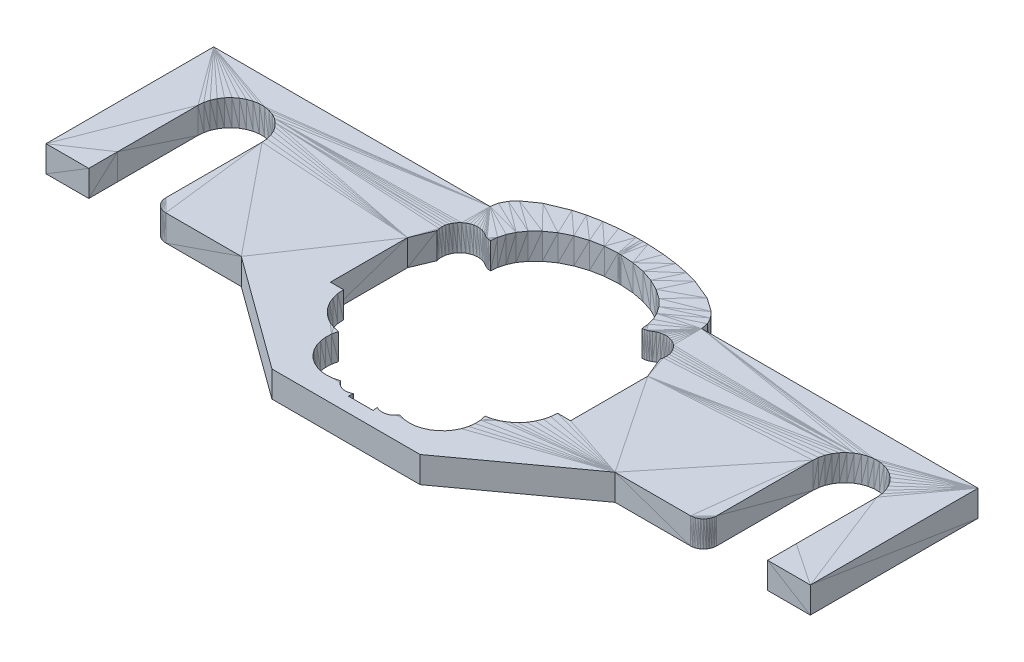
from build123d import *

# Parameters (mm, degrees)
MIRROR1_DEPTH       = 1.000000047
SKETCH2_W           = 5.756036673
SKETCH2_H           = 6.757314353
CUT_EXTRUDE1_DEPTH  = 10
SKETCH3_W           = 5.669474602
SKETCH3_H           = 1.123636748
BOSS_EXTRUDE1_DEPTH = 1
BOSS_EXTRUDE2_DEPTH = 1
CUT_EXTRUDE2_DEPTH  = 1


with BuildPart() as part:
    # Mirror1: read off the stored shape, not the designer's step
    # Mirror1 outline → Mirror1 (new body)
    with BuildSketch(Plane(origin=(0, 0, 0), x_dir=(1, 0, 0), z_dir=(0, 1, 0))):
        Polygon((1.400031033, -57.536032051), (0.860378146, -57.467374951), (0.228151679, -57.430211455), (0.047571957, -57.427730411), (0, -57.429641485), (-0.047571957, -57.427730411), (-0.228151679, -57.430211455), (-0.860378146, -57.467374951), (-1.400031033, -57.536032051), (-1.914553461, -57.637315243), (-2.355947858, -57.757604867), (-3.141701221, -58.081086725), (-3.6707744, -58.451257646), (-3.868654137, -58.67639184), (-3.999829292, -58.925494552), (-4.047423135, -59.198364615), (-14.628447592, -59.198364615), (-14.628447592, -65.615788102), (-12.991353869, -65.615788102), (-12.991353869, -64.515918493), (-12.991957366, -61.430227011), (-12.975260615, -61.228711158), (-12.925617397, -61.032690108), (-12.844391167, -60.847509652), (-12.733794749, -60.678228736), (-12.596838176, -60.529459268), (-12.437269092, -60.405258089), (-12.259431183, -60.30901894), (-12.06818223, -60.243360698), (-11.868730187, -60.210078955), (-11.66652143, -60.210078955), (-11.467069387, -60.243360698), (-11.275820434, -60.30901894), (-11.097982526, -60.405258089), (-10.938405991, -60.529459268), (-10.801456869, -60.678228736), (-10.69086045, -60.847509652), (-10.609634221, -61.032690108), (-10.559991002, -61.228711158), (-10.543294251, -61.430227011), (-10.543294251, -65.115787089), (-10.537140071, -65.194003284), (-10.518819094, -65.270297229), (-10.488800704, -65.342783928), (-10.447799228, -65.409682691), (-10.396845639, -65.46933949), (-10.33718884, -65.520294011), (-10.270290077, -65.561294556), (-10.197803378, -65.591320395), (-10.121509433, -65.609633923), (-10.043293238, -65.615788102), (-7.153794169, -65.615788102), (-2.834737301, -68.197757006), (-2.239070833, -70.110239089), (-2.239070833, -72.698362172), (-2.220600843, -72.933018208), (-2.165652812, -73.161892593), (-2.075582743, -73.379352689), (-1.952595892, -73.580041528), (-1.799732447, -73.759026825), (-1.620747033, -73.911890388), (-1.420058194, -74.034877121), (-1.202598214, -74.12494719), (-0.973723829, -74.179895222), (-0.739067793, -74.198365211), (0.739067793, -74.198365211), (0.973723829, -74.179895222), (1.202598214, -74.12494719), (1.420058194, -74.034877121), (1.620747033, -73.911890388), (1.799732447, -73.759026825), (1.952595892, -73.580041528), (2.075582743, -73.379352689), (2.165652812, -73.161892593), (2.220600843, -72.933018208), (2.239070833, -72.698362172), (2.239070833, -70.110239089), (2.834737301, -68.197757006), (7.153794169, -65.615788102), (10.043293238, -65.615788102), (10.121509433, -65.609633923), (10.197803378, -65.591320395), (10.270290077, -65.561294556), (10.33718884, -65.520294011), (10.396845639, -65.46933949), (10.447799228, -65.409682691), (10.488800704, -65.342783928), (10.518819094, -65.270297229), (10.537140071, -65.194003284), (10.543294251, -65.115787089), (10.543294251, -61.430227011), (10.559991002, -61.228711158), (10.609634221, -61.032690108), (10.69086045, -60.847509652), (10.801456869, -60.678228736), (10.938405991, -60.529459268), (11.097982526, -60.405258089), (11.275820434, -60.30901894), (11.467069387, -60.243360698), (11.66652143, -60.210078955), (11.868730187, -60.210078955), (12.06818223, -60.243360698), (12.259431183, -60.30901894), (12.437269092, -60.405258089), (12.596838176, -60.529459268), (12.733794749, -60.678228736), (12.844391167, -60.847509652), (12.925617397, -61.032690108), (12.975260615, -61.228711158), (12.991957366, -61.430227011), (12.991353869, -64.515918493), (12.991353869, -65.615788102), (14.628447592, -65.615788102), (14.628447592, -59.198364615), (4.047423135, -59.198364615), (3.999829292, -58.925494552), (3.868654137, -58.67639184), (3.6707744, -58.451257646), (3.141701221, -58.081086725), (2.355947858, -57.757604867), (1.914553461, -57.637315243), align=None)
        Polygon((-1.515604439, -68.589985371), (-1.476317644, -68.634621799), (-1.445137081, -68.685263395), (-1.422964153, -68.740442395), (-1.410432043, -68.798571825), (-1.40791398, -68.857982755), (-1.415461302, -68.916969001), (-1.432880759, -68.973824382), (-1.459650812, -69.02692467), (-1.495011034, -69.074735045), (-1.537941513, -69.115884602), (-1.587212086, -69.149181247), (-1.641400042, -69.173678756), (-1.698940992, -69.188661873), (-1.758195343, -69.193705916), (-1.817449927, -69.188661873), (-1.874998212, -69.173678756), (-1.929178834, -69.149181247), (-1.978449523, -69.115884602), (-2.021379769, -69.074735045), (-2.056740224, -69.02692467), (-2.08351016, -68.973824382), (-2.100929851, -68.916969001), (-2.108477056, -68.857982755), (-2.10595876, -68.798571825), (-2.093426883, -68.740442395), (-2.071253955, -68.685263395), (-2.040080726, -68.634621799), (-2.000786364, -68.589985371), (-1.954525709, -68.55262816), (-1.902610064, -68.523623049), (-1.846536994, -68.503819406), (-1.787930727, -68.493768573), (-1.728460193, -68.493768573), (-1.669853926, -68.503819406), (-1.613780856, -68.523623049), (-1.561865211, -68.55262816), align=None, mode=Mode.SUBTRACT)
        Polygon((0.052645802, -58.296319097), (0.545360148, -58.328106999), (1.022987184, -58.419529349), (1.471258583, -58.567862958), (1.87677145, -58.768667281), (2.227425575, -59.015952051), (2.500779927, -59.287935495), (2.689644927, -59.55644697), (2.812027931, -59.817824513), (2.880618209, -60.072798282), (2.902694046, -60.324169695), (2.980575198, -60.319405049), (3.056757152, -60.302585363), (3.129400313, -60.27411297), (3.196730977, -60.234688222), (3.296591341, -60.176812112), (3.404594958, -60.136131942), (3.517821198, -60.113750398), (3.633186454, -60.110278428), (3.747552633, -60.125809163), (3.857813776, -60.159917921), (3.960967064, -60.21168828), (4.05421108, -60.279700905), (4.135020077, -60.362111777), (4.201181233, -60.456678271), (4.250906408, -60.560833663), (4.282839596, -60.671743006), (4.296116531, -60.78639254), (4.290371668, -60.901667923), (4.265762866, -61.014428735), (4.595711827, -61.809316278), (4.595711827, -64.761281013), (4.097275436, -64.761281013), (4.07833606, -64.99889493), (4.021987319, -65.230518579), (3.929667175, -65.450280905), (3.803692758, -65.652653575), (3.64725315, -65.832510591), (3.464303911, -65.985314548), (3.259450197, -66.107206047), (3.037877381, -66.195107996), (2.805180848, -66.246800125), (2.852134407, -66.461734474), (2.861887217, -66.681526601), (2.834155923, -66.899783909), (2.769730985, -67.110143602), (2.670504153, -67.306503654), (2.53935135, -67.483142018), (2.380087739, -67.634925246), (2.197355032, -67.757442594), (1.996457577, -67.847125232), (1.783236861, -67.901358008), (1.56390667, -67.918583751), (1.344837132, -67.898280919), (1.132406178, -67.841045558), (1.08174223, -67.910581827), (1.019909978, -67.970395088), (0.948734581, -68.018727005), (0.870332122, -68.054139614), (0.78701973, -68.075589836), (0.701263547, -68.082436919), (0.615596771, -68.07448715), (0.532567501, -68.051971495), (0.454626977, -68.015545607), (0.497542322, -68.444177508), (0.601410866, -68.862244487), (0.764079392, -69.26112622), (0.98220259, -69.632597268), (1.251272974, -69.968998432), (1.290202141, -69.93535161), (1.334242639, -69.908738136), (1.382134971, -69.88991797), (1.43250823, -69.879427552), (1.483932137, -69.877572358), (1.534931478, -69.884397089), (1.584060374, -69.899708033), (1.629903913, -69.923073053), (1.671165228, -69.953821599), (1.70665246, -69.991081953), (1.735366764, -70.03378123), (1.756489277, -70.080697536), (1.769401017, -70.130512118), (1.773752156, -70.181779563), (1.773752156, -72.879813612), (1.769639435, -72.929657996), (1.757435617, -72.978161275), (1.737445593, -73.024012148), (1.710228738, -73.065973818), (1.676507178, -73.102913797), (1.637197915, -73.133841157), (1.593351364, -73.157913983), (1.546166954, -73.174484074), (1.496896148, -73.183111846), (1.446880284, -73.183558881), (1.397468033, -73.175810277), (1.3499856, -73.160082102), (1.305721817, -73.136799037), (1.265868545, -73.106579483), (1.231491566, -73.070243001), (1.086272183, -73.220975697), (0.957608223, -73.386058211), (0.884138048, -73.47856462), (0.754237175, -73.599793017), (0.595964491, -73.702678084), (0.412650406, -73.780611157), (0.210821629, -73.827385902), (0, -73.838680983), (-0.210821629, -73.827385902), (-0.412650406, -73.780611157), (-0.595964491, -73.702678084), (-0.754237175, -73.599793017), (-0.884138048, -73.47856462), (-0.957608223, -73.386058211), (-1.086272183, -73.220975697), (-1.231491566, -73.070243001), (-1.265868545, -73.106579483), (-1.305721817, -73.136799037), (-1.3499856, -73.160082102), (-1.397468033, -73.175810277), (-1.446880284, -73.183558881), (-1.496896148, -73.183111846), (-1.546166954, -73.174484074), (-1.593351364, -73.157913983), (-1.637197915, -73.133841157), (-1.676507178, -73.102913797), (-1.710228738, -73.065973818), (-1.737445593, -73.024012148), (-1.757435617, -72.978161275), (-1.769639435, -72.929657996), (-1.773752156, -72.879813612), (-1.773752156, -70.181779563), (-1.769401017, -70.130512118), (-1.756489277, -70.080697536), (-1.735366764, -70.03378123), (-1.70665246, -69.991081953), (-1.671165228, -69.953821599), (-1.629903913, -69.923073053), (-1.584060374, -69.899708033), (-1.534931478, -69.884397089), (-1.483932137, -69.877572358), (-1.43250823, -69.879427552), (-1.382134971, -69.88991797), (-1.334242639, -69.908738136), (-1.290202141, -69.93535161), (-1.251272974, -69.968998432), (-0.98220259, -69.632597268), (-0.764079392, -69.26112622), (-0.601410866, -68.862244487), (-0.497542322, -68.444177508), (-0.454626977, -68.015545607), (-0.532567501, -68.051971495), (-0.615596771, -68.07448715), (-0.701263547, -68.082436919), (-0.78701973, -68.075589836), (-0.870332122, -68.054139614), (-0.948734581, -68.018727005), (-1.019909978, -67.970395088), (-1.08174223, -67.910581827), (-1.132406178, -67.841045558), (-1.344837132, -67.898280919), (-1.56390667, -67.918583751), (-1.783236861, -67.901358008), (-1.996457577, -67.847125232), (-2.197355032, -67.757442594), (-2.380087739, -67.634925246), (-2.53935135, -67.483142018), (-2.670504153, -67.306503654), (-2.769730985, -67.110143602), (-2.834155923, -66.899783909), (-2.861887217, -66.681526601), (-2.852134407, -66.461734474), (-2.805180848, -66.246800125), (-3.037877381, -66.195107996), (-3.259450197, -66.107206047), (-3.464303911, -65.985314548), (-3.64725315, -65.832510591), (-3.803692758, -65.652653575), (-3.929667175, -65.450280905), (-4.021987319, -65.230518579), (-4.07833606, -64.99889493), (-4.097275436, -64.761281013), (-4.595711827, -64.761281013), (-4.595711827, -61.809316278), (-4.265762866, -61.014428735), (-4.290371668, -60.901667923), (-4.296116531, -60.78639254), (-4.282839596, -60.671743006), (-4.250906408, -60.560833663), (-4.201181233, -60.456678271), (-4.135020077, -60.362111777), (-4.05421108, -60.279700905), (-3.960967064, -60.21168828), (-3.857813776, -60.159917921), (-3.747552633, -60.125809163), (-3.633186454, -60.110278428), (-3.517821198, -60.113750398), (-3.404594958, -60.136131942), (-3.296591341, -60.176812112), (-3.196730977, -60.234688222), (-3.129400313, -60.27411297), (-3.056757152, -60.302585363), (-2.980575198, -60.319405049), (-2.902694046, -60.324169695), (-2.880618209, -60.072798282), (-2.812027931, -59.817824513), (-2.689644927, -59.55644697), (-2.500779927, -59.287935495), (-2.227425575, -59.015952051), (-1.87677145, -58.768667281), (-1.471258583, -58.567862958), (-1.022987184, -58.419529349), (-0.545360148, -58.328106999), (-0.052645802, -58.296319097), (0, -58.296501637), align=None, mode=Mode.SUBTRACT)
        Polygon((1.476317644, -68.634621799), (1.515604439, -68.589985371), (1.561865211, -68.55262816), (1.613780856, -68.523623049), (1.669853926, -68.503819406), (1.728460193, -68.493768573), (1.787930727, -68.493768573), (1.846536994, -68.503819406), (1.902610064, -68.523623049), (1.954525709, -68.55262816), (2.000786364, -68.589985371), (2.040080726, -68.634621799), (2.071253955, -68.685263395), (2.093426883, -68.740442395), (2.10595876, -68.798571825), (2.108477056, -68.857982755), (2.100929851, -68.916969001), (2.08351016, -68.973824382), (2.056740224, -69.02692467), (2.021379769, -69.074735045), (1.978449523, -69.115884602), (1.929178834, -69.149181247), (1.874998212, -69.173678756), (1.817449927, -69.188661873), (1.758195343, -69.193705916), (1.698940992, -69.188661873), (1.641400042, -69.173678756), (1.587212086, -69.149181247), (1.537941513, -69.115884602), (1.495011034, -69.074735045), (1.459650812, -69.02692467), (1.432880759, -68.973824382), (1.415461302, -68.916969001), (1.40791398, -68.857982755), (1.410432043, -68.798571825), (1.422964153, -68.740442395), (1.445137081, -68.685263395), align=None, mode=Mode.SUBTRACT)
    extrude(amount=MIRROR1_DEPTH)

    # Sketch2 → Cut-Extrude1 (cut)
    with BuildSketch(Plane(origin=(0, 0, 0), x_dir=(-1, 0, 0), z_dir=(0, -1, 0))):
        with Locations((-0.043281035, -71.576414183)):
            Rectangle(SKETCH2_W, SKETCH2_H)
    extrude(amount=-CUT_EXTRUDE1_DEPTH, mode=Mode.SUBTRACT)

    # Sketch3 → Boss-Extrude1 (add)
    with BuildSketch(Plane(origin=(0, 0, 0), x_dir=(-1, 0, 0), z_dir=(0, -1, 0))):
        with Locations((0, -68.75957538)):
            Rectangle(SKETCH3_W, SKETCH3_H)
    extrude(amount=-BOSS_EXTRUDE1_DEPTH)

    # Sketch4 → Boss-Extrude2 (add)
    with BuildSketch(Plane(origin=(0, 1.000000047, 0), x_dir=(1, 0, 0), z_dir=(0, 1, 0))):
        Polygon((-2.834737301, -68.75957538), (-7.153794169, -65.615788102), (-6.942920467, -65.545347417), (-2.804318933, -68.032683922), align=None)
        Polygon((2.834737301, -68.75957538), (7.153794169, -65.615788102), (2.783956233, -67.922180502), align=None)
    extrude(amount=-BOSS_EXTRUDE2_DEPTH)

    # Sketch5 → Cut-Extrude2 (cut)
    with BuildSketch(Plane(origin=(0, 1.000000047, 0), x_dir=(1, 0, 0), z_dir=(0, 1, 0))):
        Polygon((-2.834737301, -68.75957538), (2.834737301, -68.75957538), (2.834737301, -71.51652636), (-3.074538812, -71.352006484), align=None)
    extrude(amount=-CUT_EXTRUDE2_DEPTH, mode=Mode.SUBTRACT)


solid = part.part
